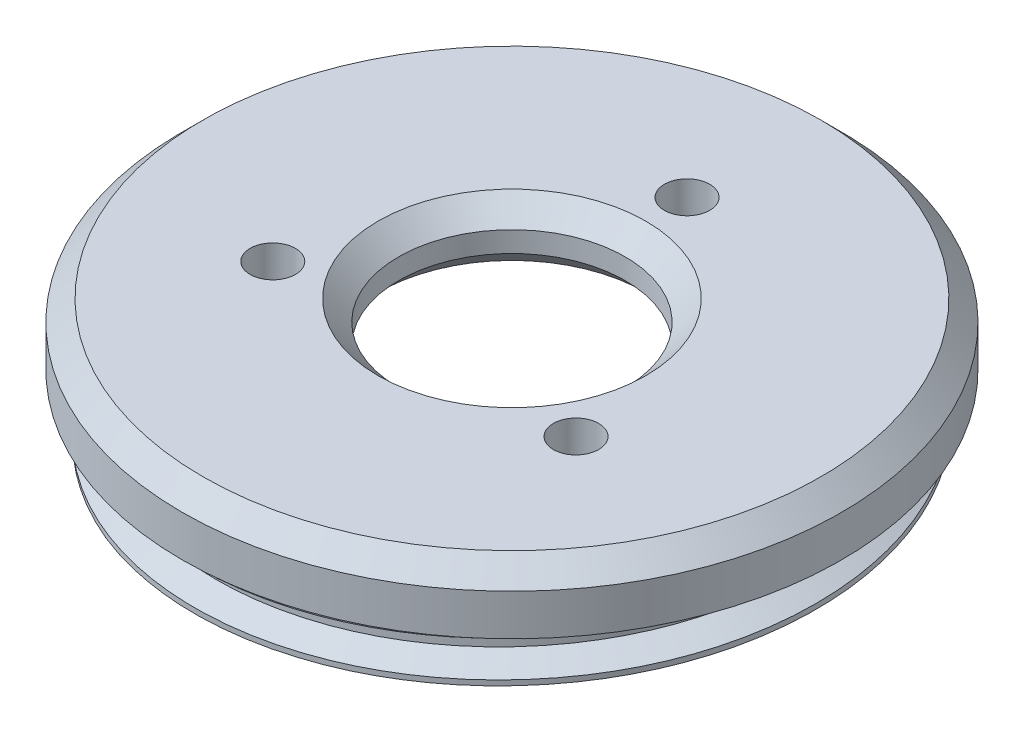
from build123d import *

# Parameters (mm, degrees)
SKETCH_1_R      = 16
SKETCH_1_R_2    = 1.1
SKETCH_1_R_3    = 5.5
EXTRUDE_1_DEPTH = 3
SKETCH_2_R      = 14
SKETCH_2_R_2    = 13
EXTRUDE_2_DEPTH = 3
THREAD_1_PITCH  = 2
THREAD_1_FROM   = 2
CHAMFER_1_SIZE  = 1
CHAMFER_2_SIZE  = 1


with BuildPart() as part:
    # Sketch 1 → Бобышка-Вытянуть1 (new body)
    with BuildSketch(Plane(origin=(0, 0, 0), x_dir=(1, 0, 0), z_dir=(0, 1, 0))):
        with Locations(Location((0, 0, 0), (0, 0, 270))):
            Circle(SKETCH_1_R)
        with Locations(Location((0, 8.5, 0), (0, 0, 270))):
            Circle(SKETCH_1_R_2, mode=Mode.SUBTRACT)
        with Locations(Location((7.361215932, -4.25, 0), (0, 0, 270))):
            Circle(SKETCH_1_R_2, mode=Mode.SUBTRACT)
        with Locations(Location((-7.361215932, -4.25, 0), (0, 0, 270))):
            Circle(SKETCH_1_R_2, mode=Mode.SUBTRACT)
        with Locations(Location((0, 0, 0), (0, 0, 270))):
            Circle(SKETCH_1_R_3, mode=Mode.SUBTRACT)
    extrude(amount=EXTRUDE_1_DEPTH)

    # Эскиз2 → Бобышка-Вытянуть2 (add)
    with BuildSketch(Plane.XZ):
        with Locations(Location((0, 0, 0), (0, 0, 90))):
            Circle(SKETCH_2_R)
        with Locations(Location((0, 0, 0), (0, 0, 270))):
            Circle(SKETCH_2_R_2, mode=Mode.SUBTRACT)
    extrude(amount=EXTRUDE_2_DEPTH)

    # Резьба1: arcs per turn and ends read off the stored shape
    # Резьба1: the profile of Sketch 1 2 profile screwed along a right-hand helix through 2.5 turns, 10 arcs to a turn; built about Z, then put on its axis
    thread_1_z = Axis((0, 0, 0), (0, 0, 1))
    thread_1_corners = [(13.9997, 0, -0.000173205), (15.08253175, 0, 0.624999997), (15.08253175, 0, 0.874999997), (13.9997, 0, 1.5001732)]
    with BuildLine(mode=Mode.PRIVATE) as thread_1_profile:
        Line(thread_1_corners[0], thread_1_corners[1])
        Line(thread_1_corners[1], thread_1_corners[2])
        Line(thread_1_corners[2], thread_1_corners[3])
        Line(thread_1_corners[3], thread_1_corners[0])
    thread_1_cap = Face(thread_1_profile.wire())
    thread_1_turn_angles = [0, 18, 36, 54, 72, 90, 108, 126, 144, 162, 180, 198, 216, 234, 252, 270, 288, 306, 324, 342, 360]
    thread_1_turn_weights = [1, 0.9510565162951535, 1, 0.9510565162951535, 1, 0.9510565162951535, 1, 0.9510565162951535, 1, 0.9510565162951535, 1, 0.9510565162951535, 1, 0.9510565162951535, 1, 0.9510565162951535, 1, 0.9510565162951535, 1, 0.9510565162951535, 1]
    thread_1_turn_rails = [Edge.make_bspline([Vector(p[0], p[1], 0).rotate(thread_1_z, thread_1_turn_angles[k]) / thread_1_turn_weights[k] + Vector(0, 0, p[2] + THREAD_1_PITCH * thread_1_turn_angles[k] / 360) for k in range(21)], [0, 0, 0, 1, 1, 2, 2, 3, 3, 4, 4, 5, 5, 6, 6, 7, 7, 8, 8, 9, 9, 10, 10, 10], 2, thread_1_turn_weights) for p in thread_1_corners]
    thread_1_turn_sides = [Face.make_surface_from_curves(thread_1_turn_rails[p[0]], thread_1_turn_rails[p[1]]) for p in [(0, 1), (1, 2), (2, 3), (3, 0)]]
    thread_1_last_angles = [720, 738, 756, 774, 792, 810, 828, 846, 864, 882, 900]
    thread_1_last_weights = [1, 0.9510565162951535, 1, 0.9510565162951535, 1, 0.9510565162951535, 1, 0.9510565162951535, 1, 0.9510565162951535, 1]
    thread_1_last_rails = [Edge.make_bspline([Vector(p[0], p[1], 0).rotate(thread_1_z, thread_1_last_angles[k]) / thread_1_last_weights[k] + Vector(0, 0, p[2] + THREAD_1_PITCH * thread_1_last_angles[k] / 360) for k in range(11)], [0, 0, 0, 1, 1, 2, 2, 3, 3, 4, 4, 5, 5, 5], 2, thread_1_last_weights) for p in thread_1_corners]
    thread_1_last_sides = [Face.make_surface_from_curves(thread_1_last_rails[p[0]], thread_1_last_rails[p[1]]) for p in [(0, 1), (1, 2), (2, 3), (3, 0)]]
    thread_1 = Plane(origin=(0, -5, 0), x_dir=(1, 0, 0), z_dir=(0, 1, 0)) * split(Solid(Shell([*[p.moved(Location((0, 0, THREAD_1_PITCH * i))) for i in range(2) for p in thread_1_turn_sides], *thread_1_last_sides, thread_1_cap, thread_1_cap.rotate(thread_1_z, 900).moved(Location((0, 0, THREAD_1_PITCH * 900 / 360)))])), bisect_by=Plane.XY.offset(THREAD_1_FROM), keep=Keep.TOP, mode=Mode.PRIVATE)
    add(thread_1)

    # Фаска1
    chamfer_1_edges = [part.edges().sort_by_distance(p)[0] for p in [
        (7.361215932, 0, 3.15),
        (-7.361215932, 0, 3.15),
        (0, 3, -16),
        (0, 0, -9.6),
        (0, 3, -5.5),
    ]]
    chamfer(chamfer_1_edges, length=CHAMFER_1_SIZE)

    # Фаска2
    # the kernel refuses this chamfer: 1 mm, written as the material it takes off along each edge
    with BuildSketch(Plane(origin=(0, 0, 0), x_dir=(0, 0, 1), z_dir=(-1, 0, 0))) as chamfer_2_piece_1:
        Polygon((5.5, CHAMFER_2_SIZE), (5.5 + CHAMFER_2_SIZE, 0), (5.5, 0), align=None)
    revolve(axis=Axis((0, 0, 0), (0, 1, 0)), mode=Mode.SUBTRACT)


solid = part.part
